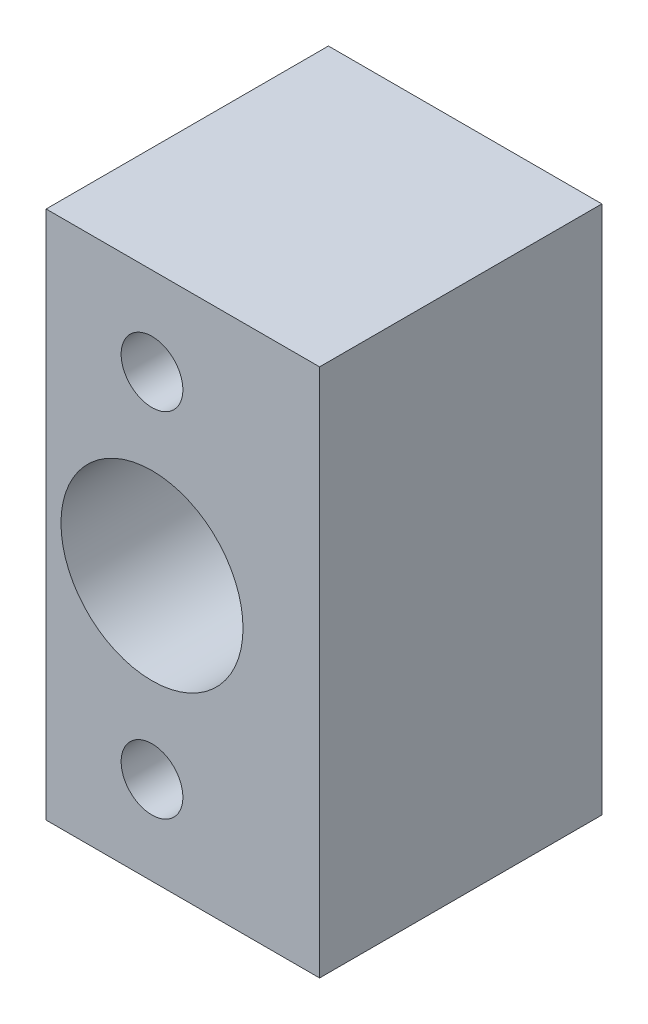
from build123d import *

# Parameters (mm, degrees)
SKETCH1_W               = 19
SKETCH1_H               = 30
BOSS_EXTRUDE1_DEPTH     = 18
SKETCH2_R               = 5.159375
CUT_EXTRUDE1_DEPTH      = 11.5
SKETCH4_R               = 4.8
CUT_EXTRUDE3_DEPTH      = 0.5
CUT_EXTRUDE4_DEPTH      = 22.430118992
CUT_EXTRUDE4_DEPTH_BACK = 8
SKETCH5_R               = 2.38125
CUT_EXTRUDE6_DEPTH      = 26.28339376
CUT_EXTRUDE6_DEPTH_BACK = 26.28339376
SKETCH11_W              = 15.5
SKETCH11_H              = 30
BOSS_EXTRUDE5_DEPTH     = 5
SKETCH12_R              = 4
CUT_EXTRUDE8_DEPTH      = 7.5
SKETCH13_R              = 1.75
CUT_EXTRUDE9_DEPTH      = 30.055980452
SKETCH15_W              = 15.5
SKETCH15_H              = 2
SKETCH15_H_2            = 5
CUT_EXTRUDE11_DEPTH     = 41
SKETCH17_R              = 5
CUT_EXTRUDE12_DEPTH     = 2
SKETCH20_R              = 3.81
CUT_EXTRUDE13_DEPTH     = 4


with BuildPart() as part:
    # Sketch1 → Boss-Extrude1 (new body)
    with BuildSketch(Plane.XY):
        Rectangle(SKETCH1_W, SKETCH1_H)
    extrude(amount=BOSS_EXTRUDE1_DEPTH)

    # Sketch2 → Cut-Extrude1 (cut)
    with BuildSketch(Plane.XY.offset(18)):
        Circle(SKETCH2_R)
    extrude(amount=-CUT_EXTRUDE1_DEPTH, mode=Mode.SUBTRACT)

    # Sketch4 → Cut-Extrude3 (cut)
    with BuildSketch(Plane.XY.offset(6.5)):
        Circle(SKETCH4_R)
    extrude(amount=-CUT_EXTRUDE3_DEPTH, mode=Mode.SUBTRACT)

    # Sketch5 → Cut-Extrude4 (cut, two sides: drawn at the far end of the back side and taken through both)
    with BuildSketch(Plane.XY.offset(6).offset(-CUT_EXTRUDE4_DEPTH_BACK)):
        Circle(SKETCH5_R)
    extrude(amount=CUT_EXTRUDE4_DEPTH + CUT_EXTRUDE4_DEPTH_BACK, mode=Mode.SUBTRACT)

    # Sketch6 → Cut-Extrude6 (cut, two sides: drawn at the far end of the back side and taken through both)
    with BuildSketch(Plane.XY.offset(-CUT_EXTRUDE6_DEPTH_BACK)):
        Polygon((-6, 92.53517602), (-6, 15), (-6, -15), (-6, -92.53517602), (-161.070352039, -92.53517602), (-161.070352039, 92.53517602), align=None)
    extrude(amount=CUT_EXTRUDE6_DEPTH + CUT_EXTRUDE6_DEPTH_BACK, mode=Mode.SUBTRACT)

    # Sketch11 → Boss-Extrude5 (add)
    with BuildSketch(Plane(origin=(0, 0, 0), x_dir=(-1, 0, 0), z_dir=(0, 0, -1))):
        with Locations((-1.75, 0)):
            Rectangle(SKETCH11_W, SKETCH11_H)
    extrude(amount=BOSS_EXTRUDE5_DEPTH)

    # Sketch12 → Cut-Extrude8 (cut)
    with BuildSketch(Plane(origin=(0, 0, -5), x_dir=(-1, 0, 0), z_dir=(0, 0, -1))):
        Circle(SKETCH12_R)
    extrude(amount=-CUT_EXTRUDE8_DEPTH, mode=Mode.SUBTRACT)

    # Sketch13 → Cut-Extrude9 (cut, through all)
    with BuildSketch(Plane(origin=(0, 0, -5), x_dir=(-1, 0, 0), z_dir=(0, 0, -1))):
        with Locations((0, -10)):
            Circle(SKETCH13_R)
        with Locations((0, 10)):
            Circle(SKETCH13_R)
    extrude(amount=-CUT_EXTRUDE9_DEPTH, mode=Mode.SUBTRACT)

    # Sketch15 → Cut-Extrude11 (cut)
    with BuildSketch(Plane.XZ.offset(15)):
        with Locations((1.75, 17)):
            Rectangle(SKETCH15_W, SKETCH15_H)
        with Locations((1.75, -2.5)):
            Rectangle(SKETCH15_W, SKETCH15_H_2)
    extrude(amount=-CUT_EXTRUDE11_DEPTH, mode=Mode.SUBTRACT)

    # Sketch17 → Cut-Extrude12 (cut)
    with BuildSketch(Plane(origin=(-6, -15, 0), x_dir=(0.9099076659797816, -0.36600957152300884, -0.19520510481227138), z_dir=(0.4148108477260767, 0.8028597052762778, 0.42819184281401484))):
        Circle(SKETCH17_R)
    extrude(amount=CUT_EXTRUDE12_DEPTH, mode=Mode.SUBTRACT)

    # Sketch20 → Cut-Extrude13 (cut)
    with BuildSketch(Plane(origin=(0, 0, 0), x_dir=(-1, 0, 0), z_dir=(0, 0, -1))):
        with Locations((0, 10)):
            Circle(SKETCH20_R)
        with Locations((0, -10)):
            Circle(SKETCH20_R)
    extrude(amount=-CUT_EXTRUDE13_DEPTH, mode=Mode.SUBTRACT)


solid = part.part
